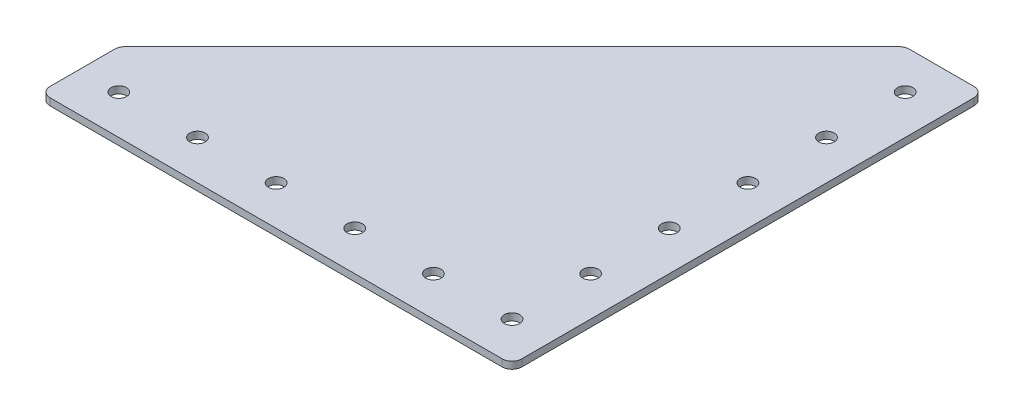
from build123d import *

# Parameters (mm, degrees)
SKETCH1_R           = 2.4892
BOSS_EXTRUDE2_DEPTH = 1.143
FILLET1_R           = 3.175
FILLET2_R           = 3.175


with BuildPart() as part:
    # Sketch1 → Boss-Extrude2 (new, symmetric)
    with BuildSketch(Plane(origin=(0, 0, 0), x_dir=(1, 0, 0), z_dir=(0, 1, 0))):
        Polygon((0, 0), (0, 152.4), (-25.4, 152.4), (-152.4, 25.4), (-152.4, 0), align=None)
        with Locations((-12.7, 12.7)):
            Circle(SKETCH1_R, mode=Mode.SUBTRACT)
        with Locations((-38.1, 12.7)):
            Circle(SKETCH1_R, mode=Mode.SUBTRACT)
        with Locations((-63.5, 12.7)):
            Circle(SKETCH1_R, mode=Mode.SUBTRACT)
        with Locations((-88.9, 12.7)):
            Circle(SKETCH1_R, mode=Mode.SUBTRACT)
        with Locations((-114.3, 12.7)):
            Circle(SKETCH1_R, mode=Mode.SUBTRACT)
        with Locations((-12.7, 38.1)):
            Circle(SKETCH1_R, mode=Mode.SUBTRACT)
        with Locations((-12.7, 63.5)):
            Circle(SKETCH1_R, mode=Mode.SUBTRACT)
        with Locations((-12.7, 88.9)):
            Circle(SKETCH1_R, mode=Mode.SUBTRACT)
        with Locations((-12.7, 114.3)):
            Circle(SKETCH1_R, mode=Mode.SUBTRACT)
        with Locations((-139.7, 12.7)):
            Circle(SKETCH1_R, mode=Mode.SUBTRACT)
        with Locations((-12.7, 139.7)):
            Circle(SKETCH1_R, mode=Mode.SUBTRACT)
    extrude(amount=BOSS_EXTRUDE2_DEPTH, both=True)

    # Fillet1
    fillet1_edges = [part.edges().sort_by_distance(p)[0] for p in [
        (0, 0, 0),
        (-152.4, 0, 0),
    ]]
    fillet(fillet1_edges, radius=FILLET1_R)

    # Fillet2
    fillet2_edges = [part.edges().sort_by_distance(p)[0] for p in [
        (-152.4, 0, -25.4),
        (0, 0, -152.4),
        (-25.4, 0, -152.4),
    ]]
    fillet(fillet2_edges, radius=FILLET2_R)


solid = part.part
